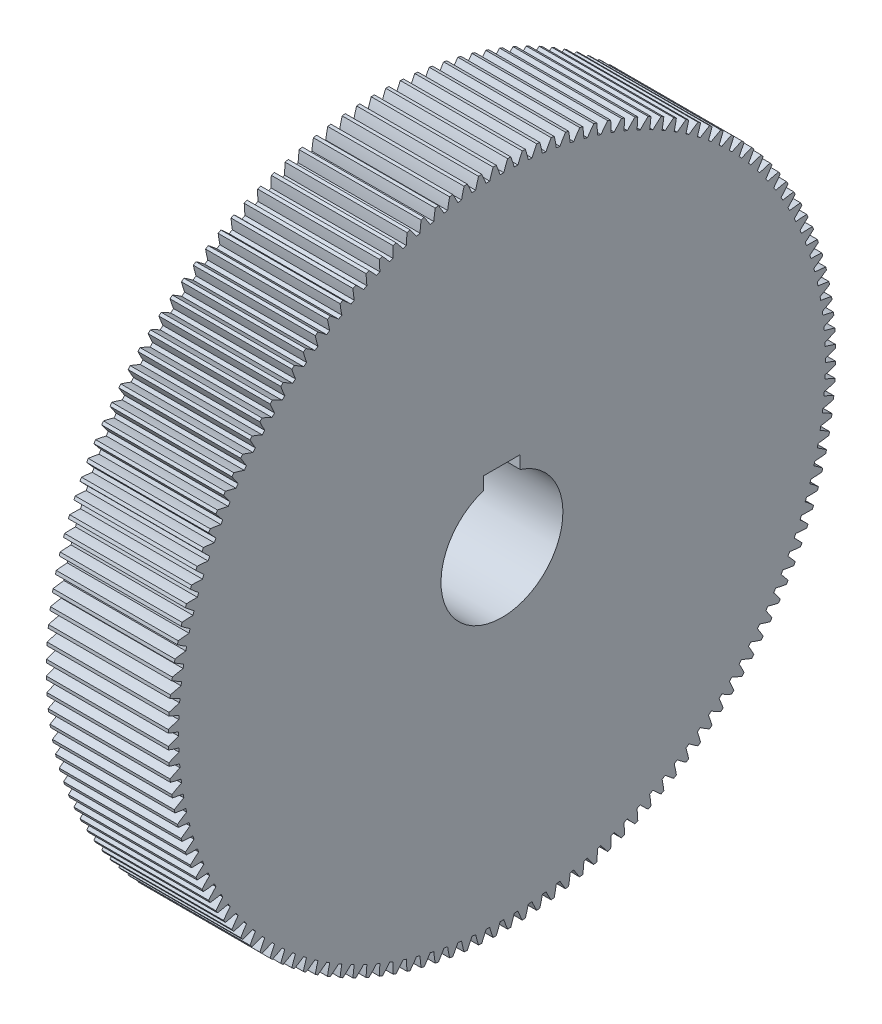
from build123d import *

# Parameters (mm, degrees)
BASPROSKE_W     = 40
BASPROSKE_H     = 109.5
TOOTHCUT_DEPTH  = 160.939050891
TEETHCUTS_COUNT = 144
TEETHCUTS_ANGLE = 357.5
BORSKE_R        = 20
BORE_DEPTH      = 50.0000508
KEYSKE_W        = 12
KEYSKE_H        = 23.3
KEYWAY_DEPTH    = 50.0000508


with BuildPart() as part:
    # BasProSke → Base-Revolve (revolve)
    with BuildSketch(Plane(origin=(0, 0, 0), x_dir=(1, 0, 0), z_dir=(0, 1, 0))):
        with Locations((20, 54.75)):
            Rectangle(BASPROSKE_W, BASPROSKE_H)
    revolve(axis=Axis((-10, 0, 0), (1, 0, 0)))

    # TooCutSke → ToothCut (cut, through all)
    with BuildSketch(Plane(origin=(0, 0, 0), x_dir=(0, 0, -1), z_dir=(1, 0, 0))):
        with BuildLine():
            ThreePointArc((0.604348814, 106.122279181), (0, 106.124), (-0.604348814, 106.122279181))
            ThreePointArc((-0.604348814, 106.122279181), (-1.208715095, 107.829149178), (-1.884077449, 109.509193666))
            ThreePointArc((-1.884077449, 109.509193666), (0, 109.5254), (1.884077449, 109.509193666))
            ThreePointArc((1.884077449, 109.509193666), (1.208715095, 107.829149178), (0.604348814, 106.122279181))
        make_face()
    toothcut = extrude(amount=TOOTHCUT_DEPTH, mode=Mode.SUBTRACT)

    # TeethCuts: ToothCut ×144 about axis
    teethcuts_axis = Axis((-10, 0, 0), (1, 0, 0))
    for i in range(1, TEETHCUTS_COUNT):
        add(toothcut.rotate(teethcuts_axis, i * TEETHCUTS_ANGLE / (TEETHCUTS_COUNT - 1)), mode=Mode.SUBTRACT)

    # BorSke → Bore (cut, symmetric)
    with BuildSketch(Plane(origin=(0, 0, 0), x_dir=(0, 0, -1), z_dir=(1, 0, 0))):
        Circle(BORSKE_R)
    extrude(amount=BORE_DEPTH, both=True, mode=Mode.SUBTRACT)

    # KeySke → Keyway (cut, symmetric)
    with BuildSketch(Plane(origin=(0, 0, 0), x_dir=(0, 0, -1), z_dir=(1, 0, 0))):
        with Locations((0, 11.65)):
            Rectangle(KEYSKE_W, KEYSKE_H)
    extrude(amount=KEYWAY_DEPTH, both=True, mode=Mode.SUBTRACT)


solid = part.part
